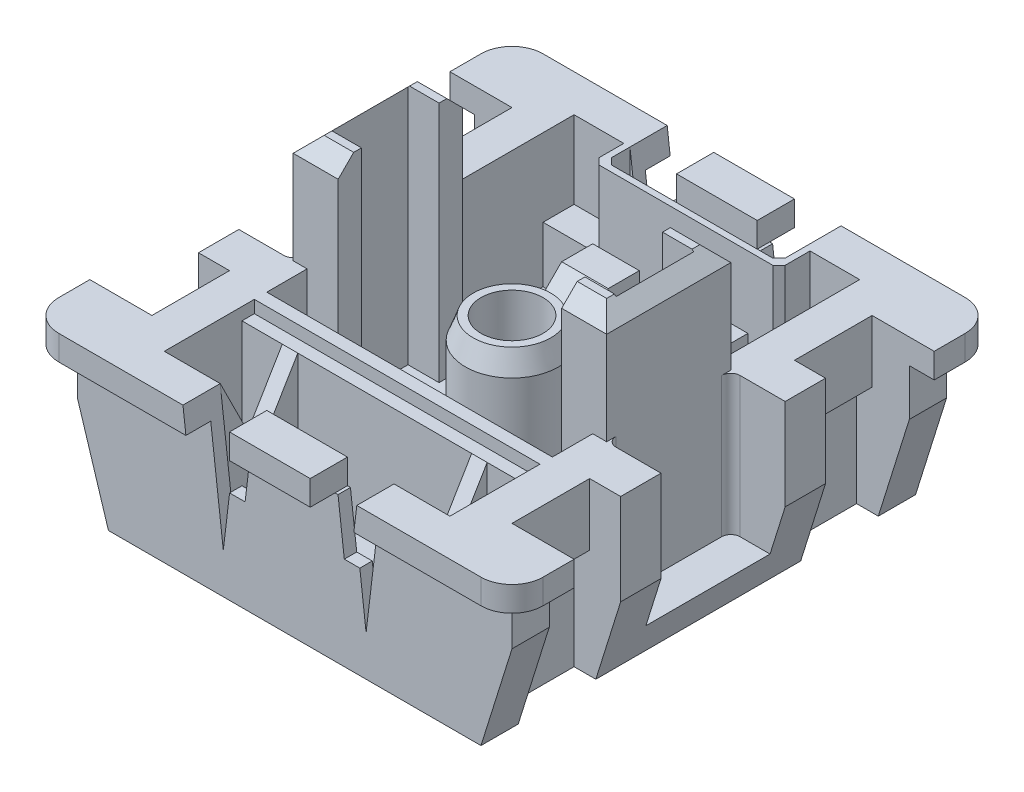
from build123d import *

# Parameters (mm, degrees)
SKETCH2_W            = 15.6
SKETCH2_H            = 15.6
BOSS_EXTRUDE1_DEPTH  = 5.5
SKETCH3_W            = 15.6
SKETCH3_H            = 15.6
SKETCH3_W_2          = 14
SKETCH3_H_2          = 14
CUT_EXTRUDE1_DEPTH   = 4.7
CUT_EXTRUDE2_DEPTH   = 18.610508227
SKETCH5_W            = 1
SKETCH5_H            = 6.6
CUT_EXTRUDE3_DEPTH   = 13.325988804
SKETCH6_W            = 1.75
SKETCH6_H            = 4
CUT_EXTRUDE4_DEPTH   = 4.5
SKETCH7_W            = 9.2
SKETCH7_H            = 13.2
CUT_EXTRUDE5_DEPTH   = 4.3
SKETCH8_W            = 9.2
SKETCH8_H            = 0.8
BOSS_EXTRUDE2_DEPTH  = 4.3
SKETCH9_W            = 9.2
SKETCH9_H            = 0.4
CUT_EXTRUDE6_DEPTH   = 0.4
CUT_EXTRUDE7_DEPTH   = 1.2
SKETCH11_W           = 0.5
SKETCH11_H           = 2.5
BOSS_EXTRUDE3_DEPTH  = 4.3
CUT_EXTRUDE8_DEPTH   = 6.6
FILLET2_R            = 0.3
FILLET3_R            = 1
SKETCH13_R           = 1.5
SKETCH13_R_2         = 1
SKETCH13_W           = 1
SKETCH13_H           = 0.75
BOSS_EXTRUDE4_DEPTH  = 4.3
BOSS_EXTRUDE5_DEPTH  = 3.5
CHAMFER3_SIZE        = 0.5
CHAMFER4_SIZE        = 0.25
CHAMFER4_SIZE2       = 0.686869355
BOSS_EXTRUDE6_DEPTH  = 2.5
CUT_EXTRUDE9_DEPTH   = 5
CUT_EXTRUDE10_DEPTH  = 4.5
CUT_EXTRUDE15_START  = -2
CUT_EXTRUDE15_DEPTH  = 2
SKETCH20_W           = 2
SKETCH20_H           = 2
CUT_EXTRUDE16_DEPTH  = 1
CHAMFER5_SIZE        = 0.5
SKETCH21_W           = 9.2
SKETCH21_H           = 1
BOSS_EXTRUDE7_DEPTH  = 4.3
CUT_EXTRUDE17_DEPTH  = 1.2
SKETCH23_W           = 5.6
SKETCH23_H           = 0.8
CUT_EXTRUDE18_DEPTH  = 4.2
CHAMFER7_SIZE        = 0.2
SKETCH24_W           = 1.6
SKETCH24_H           = 1
CUT_EXTRUDE19_DEPTH  = 2.5
CHAMFER8_SIZE        = 0.2
SKETCH25_R           = 0.25
SKETCH25_W           = 0.5
SKETCH25_H           = 0.5
CUT_EXTRUDE20_DEPTH  = 14.509996299
SKETCH26_R           = 2
BOSS_EXTRUDE8_DEPTH  = 3
CHAMFER9_SIZE        = 0.5
CUT_EXTRUDE21_START  = -2
SKETCH27_R           = 1
CUT_EXTRUDE21_DEPTH  = 2
SKETCH28_W           = 3
SKETCH28_H           = 5
SKETCH28_H_2         = 4.808714334
BOSS_EXTRUDE9_DEPTH  = 0.2
CHAMFER10_SIZE       = 1
SKETCH29_W           = 1
SKETCH29_H           = 0.6
CUT_EXTRUDE22_DEPTH  = 14.509996299
SKETCH31_W           = 0.5
SKETCH31_H           = 2.5
CUT_EXTRUDE25_DEPTH  = 4
SKETCH32_W           = 1
SKETCH32_H           = 0.1
CUT_EXTRUDE26_DEPTH  = 14.509996299
SKETCH37_W           = 0.5
SKETCH37_H           = 2.5
BOSS_EXTRUDE10_DEPTH = 0.5


with BuildPart() as part:
    # Sketch2 → Boss-Extrude1 (new body)
    with BuildSketch(Plane(origin=(0, 0, 0), x_dir=(1, 0, 0), z_dir=(0, 1, 0))):
        Rectangle(SKETCH2_W, SKETCH2_H)
    extrude(amount=BOSS_EXTRUDE1_DEPTH)

    # Sketch3 → Cut-Extrude1 (cut)
    with BuildSketch(Plane.XZ):
        Rectangle(SKETCH3_W, SKETCH3_H)
        Rectangle(SKETCH3_W_2, SKETCH3_H_2, mode=Mode.SUBTRACT)
    extrude(amount=-CUT_EXTRUDE1_DEPTH, mode=Mode.SUBTRACT)

    # Sketch4 → Cut-Extrude2 (cut, through all)
    with BuildSketch(Plane(origin=(0, 0, -7), x_dir=(-1, 0, 0), z_dir=(0, 0, -1))):
        Polygon((-7, 0), (-6, 0), (-7, 3.2), align=None)
        Polygon((7, 0), (7, 3.2), (6, 0), align=None)
    extrude(amount=-CUT_EXTRUDE2_DEPTH, mode=Mode.SUBTRACT)

    # Sketch5 → Cut-Extrude3 (cut, through all)
    with BuildSketch(Plane(origin=(0, 5.5, 0), x_dir=(1, 0, 0), z_dir=(0, 1, 0))):
        Polygon((-5.8, 3.3), (-5.8, 5.8), (-7.8, 5.8), (-7.8, 3.3), (-6.8, 3.3), align=None)
        Polygon((7.8, 5.8), (5.8, 5.8), (5.8, 3.3), (6.8, 3.3), (7.8, 3.3), align=None)
        Polygon((-5.8, -5.8), (-5.8, -3.3), (-6.8, -3.3), (-7.8, -3.3), (-7.8, -5.8), align=None)
        Polygon((6.8, -3.3), (5.8, -3.3), (5.8, -5.8), (7.8, -5.8), (7.8, -3.3), align=None)
        with Locations((-7.3, 0)):
            Rectangle(SKETCH5_W, SKETCH5_H)
        with Locations((7.3, 0)):
            Rectangle(SKETCH5_W, SKETCH5_H)
    extrude(amount=-CUT_EXTRUDE3_DEPTH, mode=Mode.SUBTRACT)

    # Sketch6 → Cut-Extrude4 (cut)
    with BuildSketch(Plane(origin=(0, 5.5, 0), x_dir=(1, 0, 0), z_dir=(0, 1, 0))):
        with Locations((-5.925, 0)):
            Rectangle(SKETCH6_W, SKETCH6_H)
        with Locations((5.925, 0)):
            Rectangle(SKETCH6_W, SKETCH6_H)
    extrude(amount=-CUT_EXTRUDE4_DEPTH, mode=Mode.SUBTRACT)

    # Sketch7 → Cut-Extrude5 (cut)
    with BuildSketch(Plane(origin=(0, 5.5, 0), x_dir=(1, 0, 0), z_dir=(0, 1, 0))):
        Rectangle(SKETCH7_W, SKETCH7_H)
    extrude(amount=-CUT_EXTRUDE5_DEPTH, mode=Mode.SUBTRACT)

    # Sketch8 → Boss-Extrude2 (add)
    with BuildSketch(Plane(origin=(0, 1.2, 0), x_dir=(1, 0, 0), z_dir=(0, 1, 0))):
        with Locations((0, -3.7)):
            Rectangle(SKETCH8_W, SKETCH8_H)
    extrude(amount=BOSS_EXTRUDE2_DEPTH)

    # Sketch9 → Cut-Extrude6 (cut)
    with BuildSketch(Plane(origin=(0, 5.5, 0), x_dir=(1, 0, 0), z_dir=(0, 1, 0))):
        with Locations((0, -3.9)):
            Rectangle(SKETCH9_W, SKETCH9_H)
    extrude(amount=-CUT_EXTRUDE6_DEPTH, mode=Mode.SUBTRACT)

    # Sketch10 → Cut-Extrude7 (cut)
    with BuildSketch(Plane.XY.offset(7.8)):
        Polygon((-1.8, 5.5), (-2.8, 5.5), (-2.704761905, 4.7), (-1.395238095, 4.7), (-1.3, 5.5), align=None)
        Polygon((-1.3, 4.7), (-1.3, 5.5), (-1.395238095, 4.7), align=None)
        Polygon((-1.395238095, 4.7), (-2.704761905, 4.7), (-2.502380952, 3), (-2.097619048, 3), (-1.597619048, 3), align=None)
        Polygon((-2.097619048, 3), (-2.502380952, 3), (-2.3, 1.3), align=None)
        Polygon((2.502380952, 3), (2.097619048, 3), (2.3, 1.3), align=None)
        Polygon((2.704761905, 4.7), (1.395238095, 4.7), (1.597619048, 3), (2.097619048, 3), (2.502380952, 3), align=None)
        Polygon((1.8, 5.5), (1.3, 5.5), (1.395238095, 4.7), (2.704761905, 4.7), (2.8, 5.5), align=None)
        Polygon((1.395238095, 4.7), (1.3, 5.5), (1.3, 4.7), align=None)
    extrude(amount=-CUT_EXTRUDE7_DEPTH, mode=Mode.SUBTRACT)

    # Sketch11 → Boss-Extrude3 (add)
    with BuildSketch(Plane(origin=(0, 1.2, 0), x_dir=(1, 0, 0), z_dir=(0, 1, 0))):
        with Locations((-3.05, -5.35)):
            Rectangle(SKETCH11_W, SKETCH11_H)
        with Locations((3.05, -5.35)):
            Rectangle(SKETCH11_W, SKETCH11_H)
    extrude(amount=BOSS_EXTRUDE3_DEPTH)

    # Sketch12 → Cut-Extrude8 (cut)
    with BuildSketch(Plane(origin=(3.3, 0, 0), x_dir=(0, 0, -1), z_dir=(1, 0, 0))):
        Polygon((-4.1, 5.1), (-5.35, 3), (-6.6, 5.5), (-4.1, 5.5), align=None)
    extrude(amount=-CUT_EXTRUDE8_DEPTH, mode=Mode.SUBTRACT)

    # Fillet2
    fillet2_edges = [part.edges().sort_by_distance(p)[0] for p in [
        (-5.05, 3.25, 2),
        (-5.05, 3.25, -2),
        (5.05, 3.25, -2),
        (5.05, 3.25, 2),
    ]]
    fillet(fillet2_edges, radius=FILLET2_R)

    # Fillet3
    fillet3_edges = [part.edges().sort_by_distance(p)[0] for p in [
        (7.8, 5.1, 7.8),
        (-7.8, 5.1, 7.8),
        (-7.8, 5.1, -7.8),
        (7.8, 5.1, -7.8),
    ]]
    fillet(fillet3_edges, radius=FILLET3_R)

    # Sketch13 → Boss-Extrude4 (add)
    # profile 1 of 5: a face of its own
    with BuildSketch(Plane(origin=(0, 1.2, 0), x_dir=(1, 0, 0), z_dir=(0, 1, 0))):
        with Locations(Location((0, 0, 0), (0, 0, 90))):
            Circle(SKETCH13_R)
        with Locations(Location((0, 0, 0), (0, 0, 90))):
            Circle(SKETCH13_R_2, mode=Mode.SUBTRACT)
    # profile 2 of 5: a face of its own
    with BuildSketch(Plane(origin=(0, 1.2, 0), x_dir=(1, 0, 0), z_dir=(0, 1, 0))):
        with Locations((4.1, 1.625)):
            Rectangle(SKETCH13_W, SKETCH13_H)
    # profile 3 of 5: a face of its own
    with BuildSketch(Plane(origin=(0, 1.2, 0), x_dir=(1, 0, 0), z_dir=(0, 1, 0))):
        with Locations((4.1, -1.625)):
            Rectangle(SKETCH13_W, SKETCH13_H)
    # profile 4 of 5: a face of its own
    with BuildSketch(Plane(origin=(0, 1.2, 0), x_dir=(1, 0, 0), z_dir=(0, 1, 0))):
        with Locations((-4.1, -1.625)):
            Rectangle(SKETCH13_W, SKETCH13_H)
    # profile 5 of 5: a face of its own
    with BuildSketch(Plane(origin=(0, 1.2, 0), x_dir=(1, 0, 0), z_dir=(0, 1, 0))):
        with Locations((-4.1, 1.625)):
            Rectangle(SKETCH13_W, SKETCH13_H)
    extrude(amount=BOSS_EXTRUDE4_DEPTH)

    # Sketch14 → Boss-Extrude5 (add)
    with BuildSketch(Plane(origin=(0, 5.5, 0), x_dir=(1, 0, 0), z_dir=(0, 1, 0))):
        Polygon((-4.6, 1.25), (-3.6, 1.25), (-3.6, 2), (-5.05, 2), (-5.05, -2), (-3.6, -2), (-3.6, -1.25), (-4.6, -1.25), align=None)
        Polygon((3.6, 1.25), (3.6, 2), (5.05, 2), (5.05, -2), (3.6, -2), (3.6, -1.25), (4.6, -1.25), (4.6, 1.25), align=None)
    extrude(amount=BOSS_EXTRUDE5_DEPTH)

    # Chamfer3
    # the kernel refuses this chamfer: 0.5 mm, written as the material it takes off along each edge
    with BuildSketch(Plane(origin=(6.335841494, 9, 2), x_dir=(-1.2246105027032903e-15, 0.027495876610585623, -0.9996219169112968), z_dir=(-1, 0, 0)), Plane(origin=(2.314158506, 9, -2), x_dir=(0, 0.027495876610585623, 0.9996219169112968), z_dir=(1, 0, 0)), Plane(origin=(-6.335841494, 9, 2), x_dir=(0, -0.9996219169112968, 0.02749587661058651), z_dir=(1, 0, 0))) as chamfer3_piece_1:
        Polygon((CHAMFER3_SIZE * 0.999621916911, CHAMFER3_SIZE * 0.0274958766106), (-CHAMFER3_SIZE * 0.0274958766106, CHAMFER3_SIZE * 0.999621916911), (0, 0), align=None)
    extrude(amount=4.021682988, mode=Mode.SUBTRACT)
    with BuildSketch(Plane(origin=(5.05, 9, -3.285841494), x_dir=(-0.9996219169112968, 0.027495876610585647, 0), z_dir=(0, 0, 1))) as chamfer3_piece_2:
        Polygon((CHAMFER3_SIZE * 0.999621916911, CHAMFER3_SIZE * 0.0274958766106), (-CHAMFER3_SIZE * 0.0274958766106, CHAMFER3_SIZE * 0.999621916911), (0, 0), align=None)
    extrude(amount=6.571682988, mode=Mode.SUBTRACT)
    with BuildSketch(Plane(origin=(-2.314158506, 9, -2), x_dir=(0, 0.027495876610585623, 0.9996219169112968), z_dir=(-1, 0, 0))) as chamfer3_piece_3:
        Polygon((CHAMFER3_SIZE * 0.999621916911, -CHAMFER3_SIZE * 0.0274958766106), (-CHAMFER3_SIZE * 0.0274958766106, -CHAMFER3_SIZE * 0.999621916911), (0, 0), align=None)
    extrude(amount=4.021682988, mode=Mode.SUBTRACT)
    with BuildSketch(Plane(origin=(-5.05, 9, -3.285841494), x_dir=(0.9996219169112968, 0.027495876610585647, 0), z_dir=(0, 0, 1))) as chamfer3_piece_4:
        Polygon((CHAMFER3_SIZE * 0.999621916911, -CHAMFER3_SIZE * 0.0274958766106), (-CHAMFER3_SIZE * 0.0274958766106, -CHAMFER3_SIZE * 0.999621916911), (0, 0), align=None)
    extrude(amount=6.571682988, mode=Mode.SUBTRACT)

    # Chamfer4
    chamfer4_edges = [part.edges().sort_by_distance(p)[0] for p in [
        (0, 5.5, 1.5),
    ]]
    chamfer4_side = [part.faces().sort_by_distance(p)[0] for p in [
        (0, 5.5, 1.457573593),
    ]]
    chamfer(chamfer4_edges, length=CHAMFER4_SIZE, length2=CHAMFER4_SIZE2, reference=chamfer4_side[0])

    # Sketch16 → Boss-Extrude6 (add)
    with BuildSketch(Plane(origin=(0, 1.2, 0), x_dir=(1, 0, 0), z_dir=(0, 1, 0))):
        with BuildLine():
            ThreePointArc((1.920937271, 1.6), (0, 2.5), (-1.920937271, 1.6))
            Line((-1.920937271, 1.6), (-2.5, 1.6))
            Line((-2.5, 1.6), (-2.5, 5.1))
            Line((-2.5, 5.1), (2.5, 5.1))
            Line((2.5, 5.1), (2.5, 1.6))
            Line((2.5, 1.6), (1.920937271, 1.6))
        make_face()
    extrude(amount=BOSS_EXTRUDE6_DEPTH)

    # Sketch17 → Cut-Extrude9 (cut)
    with BuildSketch(Plane(origin=(2.5, 0, 0), x_dir=(0, 0, -1), z_dir=(1, 0, 0))):
        Polygon((1.6, 3.7), (1.6, 3.2), (3.6, 3.2), (4.1, 3.7), align=None)
    extrude(amount=-CUT_EXTRUDE9_DEPTH, mode=Mode.SUBTRACT)

    # Sketch18 → Cut-Extrude10 (cut)
    with BuildSketch(Plane.ZY.offset(2.5)):
        Polygon((-3.6, 3.2), (-3.1, 3.2), (-3.1, 2.7), align=None)
    extrude(amount=-CUT_EXTRUDE10_DEPTH, mode=Mode.SUBTRACT)

    # Sketch19 → Cut-Extrude15 (cut)
    with BuildSketch(Plane(origin=(0, 3.2, 0), x_dir=(1, 0, 0), z_dir=(0, 1, 0)).offset(CUT_EXTRUDE15_START)):
        with BuildLine():
            Line((0, 2.5), (-1, 2.5))
            Line((-1, 2.5), (-1, 2.291287847))
            ThreePointArc((-1, 2.291287847), (-0.510774109, 2.447265782), (0, 2.5))
        make_face()
        with BuildLine():
            Line((1, 2.291287847), (1, 2.5))
            Line((1, 2.5), (0, 2.5))
            ThreePointArc((0, 2.5), (0.510774109, 2.447265782), (1, 2.291287847))
        make_face()
        Polygon((2, 3.1), (-2.5, 3.1), (-2.5, 2.5), (-1, 2.5), (0, 2.5), (1, 2.5), (2, 2.5), align=None)
    extrude(amount=CUT_EXTRUDE15_DEPTH, mode=Mode.SUBTRACT)

    # Sketch20 → Cut-Extrude16 (cut)
    with BuildSketch(Plane(origin=(0, 3.7, 0), x_dir=(1, 0, 0), z_dir=(0, 1, 0))):
        with Locations((0, 4.1)):
            Rectangle(SKETCH20_W, SKETCH20_H)
    extrude(amount=-CUT_EXTRUDE16_DEPTH, mode=Mode.SUBTRACT)

    # Chamfer5
    chamfer5_edges = [part.edges().sort_by_distance(p)[0] for p in [
        (0, 2.7, -3.1),
    ]]
    chamfer(chamfer5_edges, length=CHAMFER5_SIZE)

    # Sketch21 → Boss-Extrude7 (add)
    with BuildSketch(Plane(origin=(0, 1.2, 0), x_dir=(1, 0, 0), z_dir=(0, 1, 0))):
        with Locations((0, 6.1)):
            Rectangle(SKETCH21_W, SKETCH21_H)
    extrude(amount=BOSS_EXTRUDE7_DEPTH)

    # Sketch22 → Cut-Extrude17 (cut)
    with BuildSketch(Plane(origin=(0, 0, -7.8), x_dir=(-1, 0, 0), z_dir=(0, 0, -1))):
        Polygon((-1.3, 5.5), (-2.8, 5.5), (-2.704761905, 4.7), (-1.395238095, 4.7), align=None)
        Polygon((-1.395238095, 4.7), (-2.704761905, 4.7), (-2.502380952, 3), (-2.097619048, 3), (-1.597619048, 3), align=None)
        Polygon((-2.097619048, 3), (-2.502380952, 3), (-2.3, 1.3), align=None)
        Polygon((2.502380952, 3), (2.097619048, 3), (2.3, 1.3), align=None)
        Polygon((2.704761905, 4.7), (1.395238095, 4.7), (1.597619048, 3), (2.097619048, 3), (2.502380952, 3), align=None)
        Polygon((2.8, 5.5), (1.3, 5.5), (1.395238095, 4.7), (2.704761905, 4.7), align=None)
        Polygon((-1.3, 4.7), (-1.3, 5.5), (-1.395238095, 4.7), align=None)
        Polygon((1.395238095, 4.7), (1.3, 5.5), (1.3, 4.7), align=None)
    extrude(amount=-CUT_EXTRUDE17_DEPTH, mode=Mode.SUBTRACT)

    # Sketch23 → Cut-Extrude18 (cut)
    with BuildSketch(Plane(origin=(0, 5.5, 0), x_dir=(1, 0, 0), z_dir=(0, 1, 0))):
        with Locations((0, 6.2)):
            Rectangle(SKETCH23_W, SKETCH23_H)
    extrude(amount=-CUT_EXTRUDE18_DEPTH, mode=Mode.SUBTRACT)

    # Chamfer7
    chamfer7_edges = [part.edges().sort_by_distance(p)[0] for p in [
        (2.8, 3.4, -5.8),
        (-2.8, 3.4, -5.8),
    ]]
    chamfer(chamfer7_edges, length=CHAMFER7_SIZE)

    # Sketch24 → Cut-Extrude19 (cut)
    with BuildSketch(Plane(origin=(0, 5.5, 0), x_dir=(1, 0, 0), z_dir=(0, 1, 0))):
        with Locations((3.8, 6.1)):
            Rectangle(SKETCH24_W, SKETCH24_H)
        with Locations((-3.8, 6.1)):
            Rectangle(SKETCH24_W, SKETCH24_H)
    extrude(amount=-CUT_EXTRUDE19_DEPTH, mode=Mode.SUBTRACT)

    # Chamfer8
    chamfer8_edges = [part.edges().sort_by_distance(p)[0] for p in [
        (3, 4.25, -5.6),
        (-3, 4.25, -5.6),
    ]]
    chamfer(chamfer8_edges, length=CHAMFER8_SIZE)

    # Sketch25 → Cut-Extrude20 (cut, through all)
    with BuildSketch(Plane(origin=(0, 1.2, 0), x_dir=(1, 0, 0), z_dir=(0, 1, 0))):
        with Locations(Location((1.45, -5.35, 0), (0, 0, 270))):
            Circle(SKETCH25_R)
        with Locations(Location((-1.45, -5.35, 0), (0, 0, 270))):
            Circle(SKETCH25_R)
        with Locations((-3.95, -5.35)):
            Rectangle(SKETCH25_W, SKETCH25_H)
        with Locations((3.95, -5.35)):
            Rectangle(SKETCH25_W, SKETCH25_H)
    extrude(amount=-CUT_EXTRUDE20_DEPTH, mode=Mode.SUBTRACT)

    # Sketch26 → Boss-Extrude8 (add)
    with BuildSketch(Plane.XZ):
        with Locations(Location((0, 0, 0), (0, 0, 90))):
            Circle(SKETCH26_R)
    extrude(amount=BOSS_EXTRUDE8_DEPTH)

    # Chamfer9
    chamfer9_edges = [part.edges().sort_by_distance(p)[0] for p in [
        (0, -3, -2),
    ]]
    chamfer(chamfer9_edges, length=CHAMFER9_SIZE)

    # Sketch27 → Cut-Extrude21 (cut)
    with BuildSketch(Plane(origin=(0, 1.2, 0), x_dir=(1, 0, 0), z_dir=(0, 1, 0)).offset(CUT_EXTRUDE21_START)):
        with Locations(Location((0, 0, 0), (0, 0, 90))):
            Circle(SKETCH27_R)
    extrude(amount=CUT_EXTRUDE21_DEPTH, mode=Mode.SUBTRACT)

    # Sketch28 → Boss-Extrude9 (add)
    with BuildSketch(Plane.XZ):
        with Locations((3, -4.5)):
            Rectangle(SKETCH28_W, SKETCH28_H)
        with Locations((-3, -4.595642833)):
            Rectangle(SKETCH28_W, SKETCH28_H_2)
    extrude(amount=BOSS_EXTRUDE9_DEPTH)

    # Chamfer10
    chamfer10_edges = [part.edges().sort_by_distance(p)[0] for p in [
        (1.5, -0.1, -2),
        (-1.5, -0.1, -2.191285666),
    ]]
    chamfer(chamfer10_edges, length=CHAMFER10_SIZE)

    # Sketch29 → Cut-Extrude22 (cut, through all)
    with BuildSketch(Plane(origin=(0, 1.2, 0), x_dir=(1, 0, 0), z_dir=(0, 1, 0))):
        with Locations((-3.5, 2.8)):
            Rectangle(SKETCH29_W, SKETCH29_H)
    extrude(amount=-CUT_EXTRUDE22_DEPTH, mode=Mode.SUBTRACT)

    # Sketch31 → Cut-Extrude25 (cut)
    with BuildSketch(Plane.XZ):
        with Locations((-5.55, -4.55)):
            Rectangle(SKETCH31_W, SKETCH31_H)
        with Locations((5.55, 4.55)):
            Rectangle(SKETCH31_W, SKETCH31_H)
        with Locations((5.55, -4.55)):
            Rectangle(SKETCH31_W, SKETCH31_H)
        with Locations((-5.55, 4.55)):
            Rectangle(SKETCH31_W, SKETCH31_H)
    extrude(amount=-CUT_EXTRUDE25_DEPTH, mode=Mode.SUBTRACT)

    # Sketch32 → Cut-Extrude26 (cut, through all)
    with BuildSketch(Plane(origin=(0, 1.2, 0), x_dir=(1, 0, 0), z_dir=(0, 1, 0))):
        with Locations((2.5, 5.55)):
            Rectangle(SKETCH32_W, SKETCH32_H)
    extrude(amount=-CUT_EXTRUDE26_DEPTH, mode=Mode.SUBTRACT)

    # Sketch37 → Boss-Extrude10 (add)
    with BuildSketch(Plane.XZ.offset(-4)):
        with Locations((-5.55, -4.55)):
            Rectangle(SKETCH37_W, SKETCH37_H)
        with Locations((-5.55, 4.55)):
            Rectangle(SKETCH37_W, SKETCH37_H)
        with Locations((5.55, 4.55)):
            Rectangle(SKETCH37_W, SKETCH37_H)
        with Locations((5.55, -4.55)):
            Rectangle(SKETCH37_W, SKETCH37_H)
    extrude(amount=BOSS_EXTRUDE10_DEPTH)


solid = part.part
